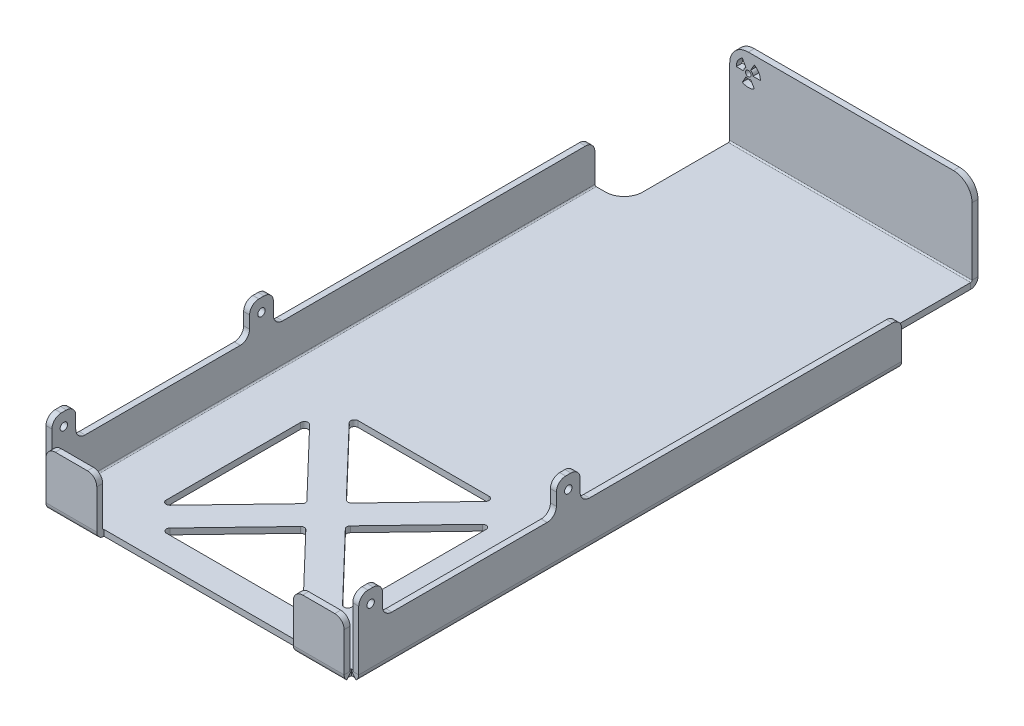
from build123d import *

# Parameters (mm, degrees)
BASE_FLANGE1_DEPTH           = 3.2
SKETCHED_START               = -176
SKETCHED_BEND1_DEPTH         = 352
SKETCHED_BEND1_2_DEPTH       = 50
SKETCHED_START_2             = -126
SKETCHED_BEND1_3_DEPTH       = 302
SKETCHED_START_3             = 56.9
SKETCHED_BEND1_4_OUTLINE_W   = 3.2
SKETCHED_BEND1_4_OUTLINE_H   = 140
SKETCHED_BEND1_4_DEPTH       = 12.8
SKETCHED_START_4             = 163.2
SKETCHED_BEND1_5_OUTLINE_W   = 3.2
SKETCHED_BEND1_5_OUTLINE_H   = 140
SKETCHED_BEND1_5_DEPTH       = 12.8
SKETCHED_BEND1_6_DEPTH       = 50
EDGE_FLANGE1_DEPTH           = 160.329677303
CORNER_START                 = 174.4
CORNER_RELIEF1_DEPTH         = 2.065887427
CORNER_START_2               = -81
CORNER_RELIEF1_2_DEPTH       = 2.435161349
CORNER_START_3               = 78.564838651
CORNER_RELIEF1_3_DEPTH       = 2.435161349
CUT_EXTRUDE1_DEPTH           = 258.769654431
CUT_EXTRUDE2_DEPTH           = 256.741872868
CUT_EXTRUDE2_DEPTH_BACK      = 256.741872868
EDGE_FLANGE2_STRIP_W         = 14.2732
EDGE_FLANGE2_STRIP_H         = 3.2
EDGE_FLANGE2_STRIP_CUT_DEPTH = 130.329677303
EDGE_FLANGE2_DEPTH           = 130.329677303
SKETCH16_R                   = 2
CUT_EXTRUDE3_DEPTH           = 297.081662207
FILLET1_R                    = 5
CUT_EXTRUDE4_DEPTH           = 256.741872868
FILLET2_R                    = 10
FILLET3_R                    = 2
CUT_EXTRUDE5_REACH           = 402.947
SKETCH18_R                   = 1.5
SKETCH19_W                   = 138.244174762
SKETCH19_H                   = 130.40415303
CUT_EXTRUDE6_DEPTH           = 297.081662207
FILLET4_R                    = 5


with BuildPart() as part:
    # Base-Flange1: sheet metal written as solids
    # Sketch1 → Base-Flange1 (new body)
    with BuildSketch(Plane(origin=(0, 0, 0), x_dir=(1, 0, 0), z_dir=(0, 1, 0))):
        Polygon((82, -176), (244.2, -176), (244.2, -163.2), (104.2, -163.2), (104.2, -69.7), (244.2, -69.7), (244.2, -56.9), (104.2, -56.9), (104.2, 126), (82, 126), (82, 176), (-82, 176), (-82, 126), (-104.2, 126), (-104.2, -56.9), (-244.2, -56.9), (-244.2, -69.7), (-104.2, -69.7), (-104.2, -163.2), (-244.2, -163.2), (-244.2, -176), (-82, -176), align=None)
    extrude(amount=BASE_FLANGE1_DEPTH)

    # Sketched Bend1: read off the stored shape, not the designer's step
    # Sketched Bend1 outline → Sketched Bend1 (cut)
    with BuildSketch(Plane.XY.offset(SKETCHED_START)):
        with BuildLine():
            ThreePointArc((84.031909894, 3.2), (82.67453186, 0.903736739), (80.164838651, 0))
            Line((80.164838651, 0), (244.2, 0))
            Line((244.2, 0), (244.2, 3.2))
            Line((244.2, 3.2), (84.031909894, 3.2))
        make_face()
        with BuildLine():
            ThreePointArc((-80.164838651, 0), (-82.67453186, 0.903736739), (-84.031909894, 3.2))
            Line((-84.031909894, 3.2), (-244.2, 3.2))
            Line((-244.2, 3.2), (-244.2, 0))
            Line((-244.2, 0), (-80.164838651, 0))
        make_face()
    extrude(amount=SKETCHED_BEND1_DEPTH, mode=Mode.SUBTRACT)

    # Sketched Bend1 2 outline → Sketched Bend1 2 (cut)
    with BuildSketch(Plane.XY.offset(SKETCHED_START)):
        Polygon((82, 3.2), (80.901438651, 3.2), (82, 2.101438651), align=None)
        Polygon((-82, 2.101438651), (-80.901438651, 3.2), (-82, 3.2), align=None)
    extrude(amount=SKETCHED_BEND1_2_DEPTH, mode=Mode.SUBTRACT)

    # Sketched Bend1 3 outline → Sketched Bend1 3 (add)
    with BuildSketch(Plane.XY.offset(SKETCHED_START_2)):
        with BuildLine():
            ThreePointArc((80.901438651, 3.9366), (80.685693506, 3.415745145), (80.164838651, 3.2))
            Line((80.164838651, 3.2), (84.031909894, 3.2))
            ThreePointArc((84.031909894, 3.2), (84.084017916, 3.566662908), (84.101438651, 3.9366))
            Line((84.101438651, 3.9366), (84.101438651, 24.301438651))
            Line((84.101438651, 24.301438651), (80.901438651, 24.301438651))
            Line((80.901438651, 24.301438651), (80.901438651, 3.9366))
        make_face()
        with BuildLine():
            ThreePointArc((-80.164838651, 3.2), (-80.685693506, 3.415745145), (-80.901438651, 3.9366))
            Line((-80.901438651, 3.9366), (-80.901438651, 24.301438651))
            Line((-80.901438651, 24.301438651), (-84.101438651, 24.301438651))
            Line((-84.101438651, 24.301438651), (-84.101438651, 3.9366))
            ThreePointArc((-84.101438651, 3.9366), (-84.084017916, 3.566662908), (-84.031909894, 3.2))
            Line((-84.031909894, 3.2), (-80.164838651, 3.2))
        make_face()
    extrude(amount=SKETCHED_BEND1_3_DEPTH)

    # Sketched Bend1 4 outline → Sketched Bend1 4 (add)
    with BuildSketch(Plane.XY.offset(SKETCHED_START_3)):
        with Locations((82.501438651, 94.301438651)):
            Rectangle(SKETCHED_BEND1_4_OUTLINE_W, SKETCHED_BEND1_4_OUTLINE_H)
        with Locations((-82.501438651, 94.301438651)):
            Rectangle(SKETCHED_BEND1_4_OUTLINE_W, SKETCHED_BEND1_4_OUTLINE_H)
    extrude(amount=SKETCHED_BEND1_4_DEPTH)

    # Sketched Bend1 5 outline → Sketched Bend1 5 (add)
    with BuildSketch(Plane.XY.offset(SKETCHED_START_4)):
        with Locations((82.501438651, 94.301438651)):
            Rectangle(SKETCHED_BEND1_5_OUTLINE_W, SKETCHED_BEND1_5_OUTLINE_H)
        with Locations((-82.501438651, 94.301438651)):
            Rectangle(SKETCHED_BEND1_5_OUTLINE_W, SKETCHED_BEND1_5_OUTLINE_H)
    extrude(amount=SKETCHED_BEND1_5_DEPTH)

    # Sketched Bend1 6 outline → Sketched Bend1 6 (add)
    with BuildSketch(Plane.XY.offset(SKETCHED_START)):
        with BuildLine():
            Line((80.901438651, 3.2), (80.685693506, 3.415745145))
            ThreePointArc((80.685693506, 3.415745145), (80.446723267, 3.256070336), (80.164838651, 3.2))
            Line((80.164838651, 3.2), (80.901438651, 3.2))
        make_face()
        with BuildLine():
            Line((82.948435206, 1.153003445), (82, 2.101438651))
            Line((82, 2.101438651), (82, 0.453928269))
            ThreePointArc((82, 0.453928269), (82.500520065, 0.76778131), (82.948435206, 1.153003445))
        make_face()
        with BuildLine():
            Line((-80.901438651, 3.2), (-80.164838651, 3.2))
            ThreePointArc((-80.164838651, 3.2), (-80.446723267, 3.256070336), (-80.685693506, 3.415745145))
            Line((-80.685693506, 3.415745145), (-80.901438651, 3.2))
        make_face()
        with BuildLine():
            Line((-82, 0.453928269), (-82, 2.101438651))
            Line((-82, 2.101438651), (-82.948435206, 1.153003445))
            ThreePointArc((-82.948435206, 1.153003445), (-82.500520065, 0.76778131), (-82, 0.453928269))
        make_face()
    extrude(amount=SKETCHED_BEND1_6_DEPTH)

    # Edge-Flange1: sheet metal written as solids
    # Edge-Flange1 section (on a plane across the edge) → Edge-Flange1 (add)
    with BuildSketch(Plane(origin=(-80.164838651, 3.2, 176.7366), x_dir=(0, 0, -1), z_dir=(1, 0, 0))):
        with BuildLine():
            Line((-3.2, 0.7366), (-3.2, 26.8))
            Line((-3.2, 26.8), (0, 26.8))
            Line((0, 26.8), (0, 0.7366))
            ThreePointArc((0, 0.7366), (0.215745145, 0.215745145), (0.7366, 0))
            Line((0.7366, 0), (0.7366, -3.2))
            ThreePointArc((0.7366, -3.2), (-2.046996555, -2.046996555), (-3.2, 0.7366))
        make_face()
    extrude(amount=EDGE_FLANGE1_DEPTH)

    # Corner Relief1: read off the stored shape, not the designer's step
    # Corner Relief1 outline → Corner Relief1 (cut)
    with BuildSketch(Plane.XY.offset(CORNER_START)):
        with BuildLine():
            Line((-80.630726179, 3.366049063), (-82.654674167, 0.887413442))
            ThreePointArc((-82.654674167, 0.887413442), (-81.486464876, 0.228484079), (-80.164838651, 0))
            Line((-80.164838651, 0), (-78.564838651, 0))
            Line((-78.564838651, 0), (-78.564838651, 3.2))
            Line((-78.564838651, 3.2), (-80.164838651, 3.2))
            ThreePointArc((-80.164838651, 3.2), (-80.41213578, 3.242752978), (-80.630726179, 3.366049063))
        make_face()
        with BuildLine():
            Line((78.564838651, 3.2), (78.564838651, 0))
            Line((78.564838651, 0), (80.164838651, 0))
            ThreePointArc((80.164838651, 0), (81.486464876, 0.228484079), (82.654674167, 0.887413442))
            Line((82.654674167, 0.887413442), (80.630726179, 3.366049063))
            ThreePointArc((80.630726179, 3.366049063), (80.41213578, 3.242752978), (80.164838651, 3.2))
            Line((80.164838651, 3.2), (78.564838651, 3.2))
        make_face()
    extrude(amount=CORNER_RELIEF1_DEPTH, mode=Mode.SUBTRACT)

    # Corner Relief1 2 outline → Corner Relief1 2 (cut)
    with BuildSketch(Plane.YZ.offset(CORNER_START_2)):
        with BuildLine():
            Line((3.366049063, 176.465887527), (0.887413442, 178.489835515))
            ThreePointArc((0.887413442, 178.489835515), (0.313348225, 177.539112125), (0.027665559, 176.465887427))
            Line((0.027665559, 176.465887427), (3.2, 176.465887427))
            Line((3.2, 176.465887427), (3.2, 176))
            ThreePointArc((3.2, 176), (3.242752978, 176.247297129), (3.366049063, 176.465887527))
        make_face()
    extrude(amount=CORNER_RELIEF1_2_DEPTH, mode=Mode.SUBTRACT)

    # Corner Relief1 3 outline → Corner Relief1 3 (cut)
    with BuildSketch(Plane.YZ.offset(CORNER_START_3)):
        with BuildLine():
            Line((3.366049063, 176.465887527), (0.887413442, 178.489835515))
            ThreePointArc((0.887413442, 178.489835515), (0.313348225, 177.539112125), (0.027665559, 176.465887427))
            Line((0.027665559, 176.465887427), (3.2, 176.465887427))
            Line((3.2, 176.465887427), (3.2, 176))
            ThreePointArc((3.2, 176), (3.242752978, 176.247297129), (3.366049063, 176.465887527))
        make_face()
    extrude(amount=CORNER_RELIEF1_3_DEPTH, mode=Mode.SUBTRACT)

    # Sketch10 → Cut-Extrude1 (cut, through all)
    with BuildSketch(Plane.XZ):
        Polygon((-52.864838651, 176), (0, 176), (52.864838651, 176), (52.864838651, 179.9366), (-52.864838651, 179.9366), align=None)
    extrude(amount=-CUT_EXTRUDE1_DEPTH, mode=Mode.SUBTRACT)

    # Sketch11 → Cut-Extrude2 (cut, two sides: drawn at the far end of the back side and taken through both)
    with BuildSketch(Plane(origin=(0, 3.2, 0), x_dir=(1, 0, 0), z_dir=(0, 1, 0)).offset(-CUT_EXTRUDE2_DEPTH_BACK)):
        Polygon((80.164838651, 116), (65.164838651, 116), (65.164838651, 176), (95.164838651, 176), (95.164838651, 116), align=None)
        Polygon((-95.164838651, 176), (-95.164838651, 116), (-80.164838651, 116), (-65.164838651, 116), (-65.164838651, 176), align=None)
    extrude(amount=CUT_EXTRUDE2_DEPTH + CUT_EXTRUDE2_DEPTH_BACK, mode=Mode.SUBTRACT)

    # Edge-Flange2: sheet metal written as solids
    # Edge-Flange2 strip (on a plane across the edge) → Edge-Flange2 strip cut (cut)
    with BuildSketch(Plane(origin=(65.164838651, 3.2, -176), x_dir=(0, 0, 1), z_dir=(-1, 0, 0))):
        with Locations((-3.2, -1.6)):
            Rectangle(EDGE_FLANGE2_STRIP_W, EDGE_FLANGE2_STRIP_H)
    extrude(amount=EDGE_FLANGE2_STRIP_CUT_DEPTH, mode=Mode.SUBTRACT)

    # Edge-Flange2 section (on a plane across the edge) → Edge-Flange2 (add)
    with BuildSketch(Plane(origin=(65.164838651, 3.2, -176), x_dir=(0, 0, 1), z_dir=(-1, 0, 0))):
        with BuildLine():
            Line((0, 0.7366), (0, 46.8))
            Line((0, 46.8), (3.2, 46.8))
            Line((3.2, 46.8), (3.2, 0.7366))
            ThreePointArc((3.2, 0.7366), (3.415745145, 0.215745145), (3.9366, 0))
            Line((3.9366, 0), (3.9366, -3.2))
            ThreePointArc((3.9366, -3.2), (1.153003445, -2.046996555), (0, 0.7366))
        make_face()
    extrude(amount=EDGE_FLANGE2_DEPTH)

    # Sketch16 → Cut-Extrude3 (cut, through all)
    with BuildSketch(Plane(origin=(84.101438651, 0, 0), x_dir=(0, 0, -1), z_dir=(1, 0, 0))):
        with Locations(Location((-63.3, 33.9366, 0), (0, 0, 90))):
            Circle(SKETCH16_R)
        with Locations(Location((-63.3, 153.9366, 0), (0, 0, 90))):
            Circle(SKETCH16_R)
        with Locations(Location((-63.3, 138.9366, 0), (0, 0, 90))):
            Circle(SKETCH16_R)
        with Locations(Location((-169.6, 138.9366, 0), (0, 0, 90))):
            Circle(SKETCH16_R)
        with Locations(Location((-169.6, 153.9366, 0), (0, 0, 90))):
            Circle(SKETCH16_R)
        with Locations(Location((-169.6, 33.9366, 0), (0, 0, 90))):
            Circle(SKETCH16_R)
    extrude(amount=-CUT_EXTRUDE3_DEPTH, mode=Mode.SUBTRACT)

    # Fillet1
    fillet1_edges = [part.edges().sort_by_distance(p)[0] for p in [
        (82.501438651, 24.301438651, 56.9),
        (82.501438651, 164.301438651, 69.7),
        (82.501438651, 24.301438651, 69.7),
        (82.501438651, 24.301438651, 163.2),
        (82.501438651, 164.301438651, 163.2),
        (-82.501438651, 164.301438651, 163.2),
        (-82.501438651, 24.301438651, 163.2),
        (-82.501438651, 24.301438651, 69.7),
        (-82.501438651, 164.301438651, 69.7),
        (-82.501438651, 24.301438651, 56.9),
        (-80.164838651, 30, 178.3366),
        (80.164838651, 30, 178.3366),
        (-52.864838651, 30, 178.3366),
        (52.864838651, 30, 178.3366),
        (82.501438651, 24.301438651, -116),
        (-82.501438651, 24.301438651, -116),
    ]]
    fillet(fillet1_edges, radius=FILLET1_R)

    # Sketch17 → Cut-Extrude4 (cut, through all)
    with BuildSketch(Plane(origin=(0, 3.2, 0), x_dir=(1, 0, 0), z_dir=(0, 1, 0))):
        Polygon((-49.864838651, -68.290127364), (-49.864838651, -150.61800082), (-10.391125898, -109.454064092), align=None)
        Polygon((-39.909132614, -57), (0, -98.61800082), (39.909132614, -57), align=None)
        Polygon((49.864838651, -68.290127364), (10.391125898, -109.454064092), (49.864838651, -150.61800082), align=None)
        Polygon((0, -120.290127364), (-39.038292894, -161), (39.038292894, -161), align=None)
    extrude(amount=-CUT_EXTRUDE4_DEPTH, mode=Mode.SUBTRACT)

    # Fillet2
    fillet2_edges = [part.edges().sort_by_distance(p)[0] for p in [
        (65.164838651, 1.6, -116),
        (-65.164838651, 1.6, -116),
        (65.164838651, 50, -174.4),
        (-65.164838651, 50, -174.4),
    ]]
    fillet(fillet2_edges, radius=FILLET2_R)

    # Fillet3
    fillet3_edges = [part.edges().sort_by_distance(p)[0] for p in [
        (82.501438651, 164.301438651, 56.9),
        (82.501438651, 164.301438651, 176),
        (-82.501438651, 164.301438651, 56.9),
        (-82.501438651, 164.301438651, 176),
        (49.864838651, 1.6, 150.61800082),
        (10.391125898, 1.6, 109.454064092),
        (49.864838651, 1.6, 68.290127364),
        (0, 1.6, 98.61800082),
        (-39.909132614, 1.6, 57),
        (39.909132614, 1.6, 57),
        (0, 1.6, 120.290127364),
        (39.038292894, 1.6, 161),
        (-39.038292894, 1.6, 161),
        (-49.864838651, 1.6, 68.290127364),
        (-10.391125898, 1.6, 109.454064092),
        (-49.864838651, 1.6, 150.61800082),
    ]]
    fillet(fillet3_edges, radius=FILLET3_R)

    # Sketch18 → Cut-Extrude5 (cut, up to next)
    with BuildSketch(Plane(origin=(0, 0, -176), x_dir=(-1, 0, 0), z_dir=(0, 0, -1)), mode=Mode.PRIVATE) as cut_extrude5_sk1:
        with Locations(Location((55.164838651, 40, 0), (0, 0, 90))):
            Circle(SKETCH18_R)
    cut_extrude5_tool1 = extrude(cut_extrude5_sk1.sketch, amount=-CUT_EXTRUDE5_REACH, mode=Mode.PRIVATE) & part.part
    # Sketch18 → Cut-Extrude5 (cut, up to next)
    with BuildSketch(Plane(origin=(0, 0, -176), x_dir=(-1, 0, 0), z_dir=(0, 0, -1)), mode=Mode.PRIVATE) as cut_extrude5_sk2:
        with BuildLine():
            Line((61.664838651, 40), (57.664838651, 40))
            ThreePointArc((57.664838651, 40), (57.329902161, 41.25), (56.414838651, 42.165063509))
            Line((56.414838651, 42.165063509), (58.414838651, 45.629165125))
            ThreePointArc((58.414838651, 45.629165125), (60.794003776, 43.25), (61.664838651, 40))
        make_face()
    cut_extrude5_tool2 = extrude(cut_extrude5_sk2.sketch, amount=-CUT_EXTRUDE5_REACH, mode=Mode.PRIVATE) & part.part
    # Sketch18 → Cut-Extrude5 (cut, up to next)
    with BuildSketch(Plane(origin=(0, 0, -176), x_dir=(-1, 0, 0), z_dir=(0, 0, -1)), mode=Mode.PRIVATE) as cut_extrude5_sk3:
        with BuildLine():
            Line((58.414838651, 34.370834875), (56.414838651, 37.834936491))
            ThreePointArc((56.414838651, 37.834936491), (55.164838651, 37.5), (53.914838651, 37.834936491))
            Line((53.914838651, 37.834936491), (51.914838651, 34.370834875))
            ThreePointArc((51.914838651, 34.370834875), (55.164838651, 33.5), (58.414838651, 34.370834875))
        make_face()
    cut_extrude5_tool3 = extrude(cut_extrude5_sk3.sketch, amount=-CUT_EXTRUDE5_REACH, mode=Mode.PRIVATE) & part.part
    # Sketch18 → Cut-Extrude5 (cut, up to next)
    with BuildSketch(Plane(origin=(0, 0, -176), x_dir=(-1, 0, 0), z_dir=(0, 0, -1)), mode=Mode.PRIVATE) as cut_extrude5_sk4:
        with BuildLine():
            Line((48.664838651, 40), (52.664838651, 40))
            ThreePointArc((52.664838651, 40), (52.999775142, 41.25), (53.914838651, 42.165063509))
            Line((53.914838651, 42.165063509), (51.914838651, 45.629165125))
            ThreePointArc((51.914838651, 45.629165125), (49.535673527, 43.25), (48.664838651, 40))
        make_face()
    cut_extrude5_tool4 = extrude(cut_extrude5_sk4.sketch, amount=-CUT_EXTRUDE5_REACH, mode=Mode.PRIVATE) & part.part
    add(cut_extrude5_tool1.solids().sort_by_distance((-55.164839, 40, -176))[0], mode=Mode.SUBTRACT)
    add(cut_extrude5_tool2.solids().sort_by_distance((-59.131344, 42.290063, -176))[0], mode=Mode.SUBTRACT)
    add(cut_extrude5_tool3.solids().sort_by_distance((-55.164839, 35.419874, -176))[0], mode=Mode.SUBTRACT)
    add(cut_extrude5_tool4.solids().sort_by_distance((-51.198334, 42.290063, -176))[0], mode=Mode.SUBTRACT)

    # Sketch19 → Cut-Extrude6 (cut, through all)
    with BuildSketch(Plane(origin=(84.101438651, 0, 0), x_dir=(0, 0, -1), z_dir=(1, 0, 0))):
        with Locations((-117.012259557, 106.138676515)):
            Rectangle(SKETCH19_W, SKETCH19_H)
    extrude(amount=-CUT_EXTRUDE6_DEPTH, mode=Mode.SUBTRACT)

    # Fillet4
    fillet4_edges = [part.edges().sort_by_distance(p)[0] for p in [
        (-82.501438651, 40.9366, 176),
        (82.501438651, 40.9366, 56.9),
        (82.501438651, 40.9366, 69.7),
        (82.501438651, 40.9366, 163.2),
        (82.501438651, 40.9366, 176),
        (-82.501438651, 40.9366, 69.7),
        (-82.501438651, 40.9366, 56.9),
        (-82.501438651, 40.9366, 163.2),
    ]]
    fillet(fillet4_edges, radius=FILLET4_R)


solid = part.part
